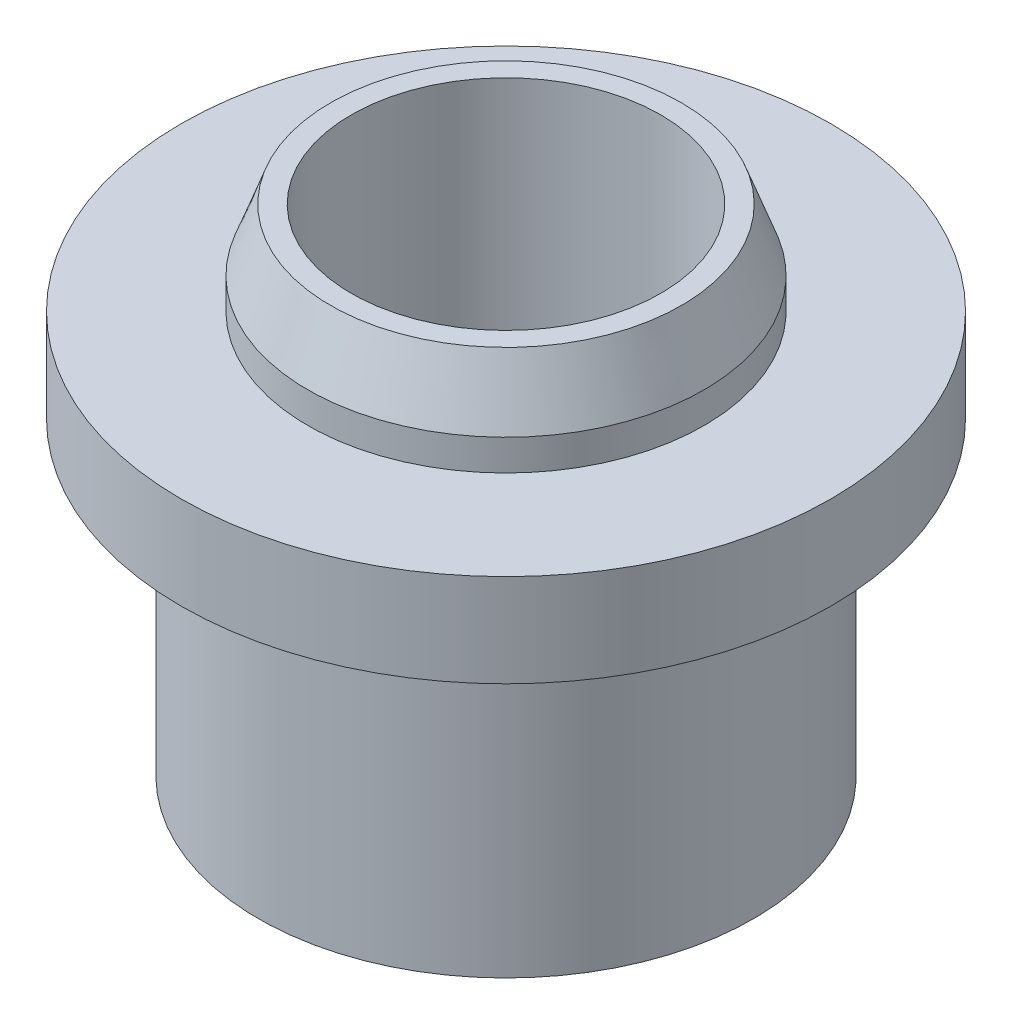
from build123d import *


with BuildPart() as part:
    # Sketch1 → Revolve1 (revolve)
    with BuildSketch(Plane.XY):
        Polygon((2.5, -0.076264179), (2.5, 6.423735821), (2.5, 7.923735821), (2.836029766, 7.923735821), (3.2, 6.923735821), (3.2, 6.423735821), (5.25, 6.423735821), (5.25, 4.923735821), (4, 4.923735821), (4, -0.076264179), align=None)
    revolve(axis=Axis((0, 0, 0), (0, 1, 0)))


solid = part.part
